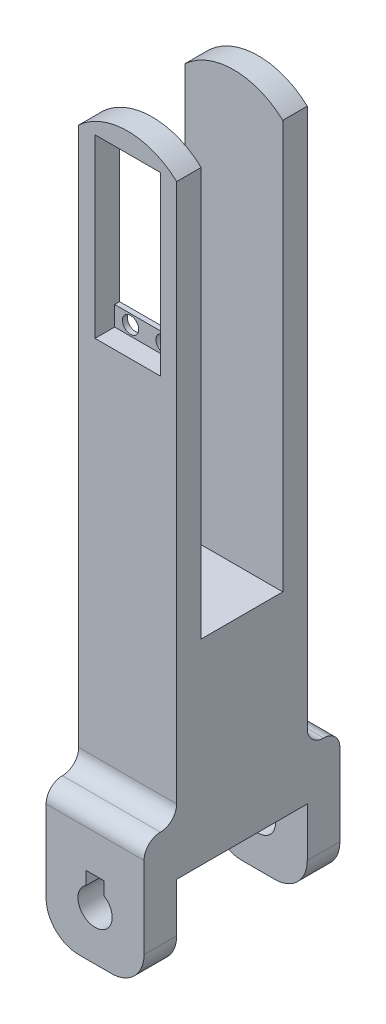
from build123d import *

# Parameters (mm, degrees)
SKETCH2_W               = 30
SKETCH2_H               = 30
BOSS_EXTRUDE1_DEPTH     = 60
FILLET1_R               = 10
SKETCH3_W               = 40
SKETCH3_H               = 25
CUT_EXTRUDE1_DEPTH      = 69.738635424
SKETCH6_W               = 30
SKETCH6_H               = 40
BOSS_EXTRUDE2_DEPTH     = 125
SKETCH7_W               = 30
SKETCH7_H               = 10
BOSS_EXTRUDE3_DEPTH     = 10
FILLET2_START           = -16
FILLET2_DEPTH           = 32
FILLET2_START_2         = -15
FILLET2_2_DEPTH         = 30
SKETCH8_W               = 25
SKETCH8_H               = 70
CUT_EXTRUDE2_DEPTH      = 156.241746963
SKETCH12_W              = 30
SKETCH12_H              = 7.5
BOSS_EXTRUDE4_DEPTH     = 65
CUT_EXTRUDE3_DEPTH      = 212.541958013
CUT_EXTRUDE3_DEPTH_BACK = 7.5
SKETCH13_R              = 2.5
SKETCH13_W              = 20
SKETCH13_H              = 42
SKETCH14_W              = 20
SKETCH14_H              = 54
CUT_EXTRUDE4_DEPTH      = 6
SKETCH15_R              = 5
BOSS_EXTRUDE5_DEPTH     = 10
CUT_EXTRUDE5_REACH      = 213.542


with BuildPart() as part:
    # Sketch2 → Boss-Extrude1 (new body)
    with BuildSketch(Plane.XY):
        Rectangle(SKETCH2_W, SKETCH2_H)
        with BuildLine():
            ThreePointArc((5.25, 0), (-2.561737691, -4.582575695), (-2.75, 4.472135955))
            Line((-2.75, 4.472135955), (-2.75, 8.5))
            Line((-2.75, 8.5), (0, 8.5))
            Line((0, 8.5), (2.75, 8.5))
            Line((2.75, 8.5), (2.75, 4.472135955))
            ThreePointArc((2.75, 4.472135955), (4.582575695, 2.561737691), (5.25, 0))
        make_face(mode=Mode.SUBTRACT)
    extrude(amount=BOSS_EXTRUDE1_DEPTH)

    # Fillet1
    fillet1_edges = [part.edges().sort_by_distance(p)[0] for p in [
        (15, -15, 30),
        (-15, -15, 30),
    ]]
    fillet(fillet1_edges, radius=FILLET1_R)

    # Sketch3 → Cut-Extrude1 (cut, through all)
    with BuildSketch(Plane.ZY.offset(15)):
        with Locations((30, -2.5)):
            Rectangle(SKETCH3_W, SKETCH3_H)
    extrude(amount=-CUT_EXTRUDE1_DEPTH, mode=Mode.SUBTRACT)

    # Sketch6 → Boss-Extrude2 (add)
    with BuildSketch(Plane(origin=(0, 15, 0), x_dir=(1, 0, 0), z_dir=(0, 1, 0))):
        with Locations((0, -30)):
            Rectangle(SKETCH6_W, SKETCH6_H)
    extrude(amount=BOSS_EXTRUDE2_DEPTH)

    # Sketch7 → Boss-Extrude3 (add)
    with BuildSketch(Plane(origin=(0, 15, 0), x_dir=(1, 0, 0), z_dir=(0, 1, 0))):
        with Locations((0, -5)):
            Rectangle(SKETCH7_W, SKETCH7_H)
        with Locations((0, -55)):
            Rectangle(SKETCH7_W, SKETCH7_H)
    extrude(amount=BOSS_EXTRUDE3_DEPTH)

    # Fillet2: read off the stored shape, not the designer's step
    # Fillet2 outline → Fillet2 (cut)
    with BuildSketch(Plane.YZ.offset(FILLET2_START)):
        with BuildLine():
            ThreePointArc((25, 5), (23.535533906, 1.464466094), (20, 0))
            Line((20, 0), (25, 0))
            Line((25, 0), (25, 5))
        make_face()
        with BuildLine():
            Line((25, 60), (20, 60))
            ThreePointArc((20, 60), (23.535533906, 58.535533906), (25, 55))
            Line((25, 55), (25, 60))
        make_face()
    extrude(amount=FILLET2_DEPTH, mode=Mode.SUBTRACT)

    # Fillet2 2 outline → Fillet2 2 (add)
    with BuildSketch(Plane.YZ.offset(FILLET2_START_2)):
        with BuildLine():
            Line((25, 10), (25, 5))
            ThreePointArc((25, 5), (26.464466094, 8.535533906), (30, 10))
            Line((30, 10), (25, 10))
        make_face()
        with BuildLine():
            ThreePointArc((30, 50), (26.464466094, 51.464466094), (25, 55))
            Line((25, 55), (25, 50))
            Line((25, 50), (30, 50))
        make_face()
    extrude(amount=FILLET2_2_DEPTH)

    # Sketch8 → Cut-Extrude2 (cut, through all)
    with BuildSketch(Plane(origin=(15, 0, 0), x_dir=(0, 0, -1), z_dir=(1, 0, 0))):
        with Locations((-30, 105)):
            Rectangle(SKETCH8_W, SKETCH8_H)
    extrude(amount=-CUT_EXTRUDE2_DEPTH, mode=Mode.SUBTRACT)

    # Sketch12 → Boss-Extrude4 (add)
    with BuildSketch(Plane(origin=(0, 140, 0), x_dir=(1, 0, 0), z_dir=(0, 1, 0))):
        with Locations((0, -13.75)):
            Rectangle(SKETCH12_W, SKETCH12_H)
        with Locations((0, -46.25)):
            Rectangle(SKETCH12_W, SKETCH12_H)
    extrude(amount=BOSS_EXTRUDE4_DEPTH)

    # Sketch13 → Cut-Extrude3 (cut, two sides: drawn at the far end of the back side and taken through both)
    with BuildSketch(Plane.XY.offset(50).offset(-CUT_EXTRUDE3_DEPTH_BACK)):
        with Locations((-5.125, 192)):
            Circle(SKETCH13_R)
        with Locations((5.125, 192)):
            Circle(SKETCH13_R)
        with Locations((-5.125, 144)):
            Circle(SKETCH13_R)
        with Locations((5.125, 144)):
            Circle(SKETCH13_R)
        with Locations((0, 168)):
            Rectangle(SKETCH13_W, SKETCH13_H)
    extrude(amount=CUT_EXTRUDE3_DEPTH + CUT_EXTRUDE3_DEPTH_BACK, mode=Mode.SUBTRACT)

    # Sketch14 → Cut-Extrude4 (cut)
    with BuildSketch(Plane.XY.offset(50)):
        with Locations((0, 168)):
            Rectangle(SKETCH14_W, SKETCH14_H)
    extrude(amount=-CUT_EXTRUDE4_DEPTH, mode=Mode.SUBTRACT)

    # Sketch15 → Boss-Extrude5 (add)
    with BuildSketch(Plane(origin=(0, 0, 10), x_dir=(-1, 0, 0), z_dir=(0, 0, -1))):
        with Locations(Location((0, 179, 0), (0, 0, 180))):
            Circle(SKETCH15_R)
    extrude(amount=BOSS_EXTRUDE5_DEPTH)

    # Cut-Extrude5: up to this face of the body (flat: up to its plane)
    cut_extrude5_end = Plane(part.part.faces().sort_by_distance((0, 104.420863309, 50))[0])
    # Sketch18 → Cut-Extrude5 (cut, up to the picked face)
    with BuildSketch(Plane(origin=(0, 0, 10), x_dir=(-1, 0, 0), z_dir=(0, 0, -1)), mode=Mode.PRIVATE) as cut_extrude5_sk1:
        with BuildLine():
            Line((-15, 195.093476939), (-15, 205))
            Line((-15, 205), (15, 205))
            Line((15, 205), (15, 195.093476939))
            ThreePointArc((15, 195.093476939), (0, 201), (-15, 195.093476939))
        make_face()
    cut_extrude5_tool1 = split(extrude(cut_extrude5_sk1.sketch, amount=-CUT_EXTRUDE5_REACH, mode=Mode.PRIVATE), bisect_by=cut_extrude5_end, keep=Keep.BOTH, mode=Mode.PRIVATE)
    add(cut_extrude5_tool1.solids().sort_by(Axis((0, 201.823225, 10), (0, 0, 1)))[0], mode=Mode.SUBTRACT)


solid = part.part
